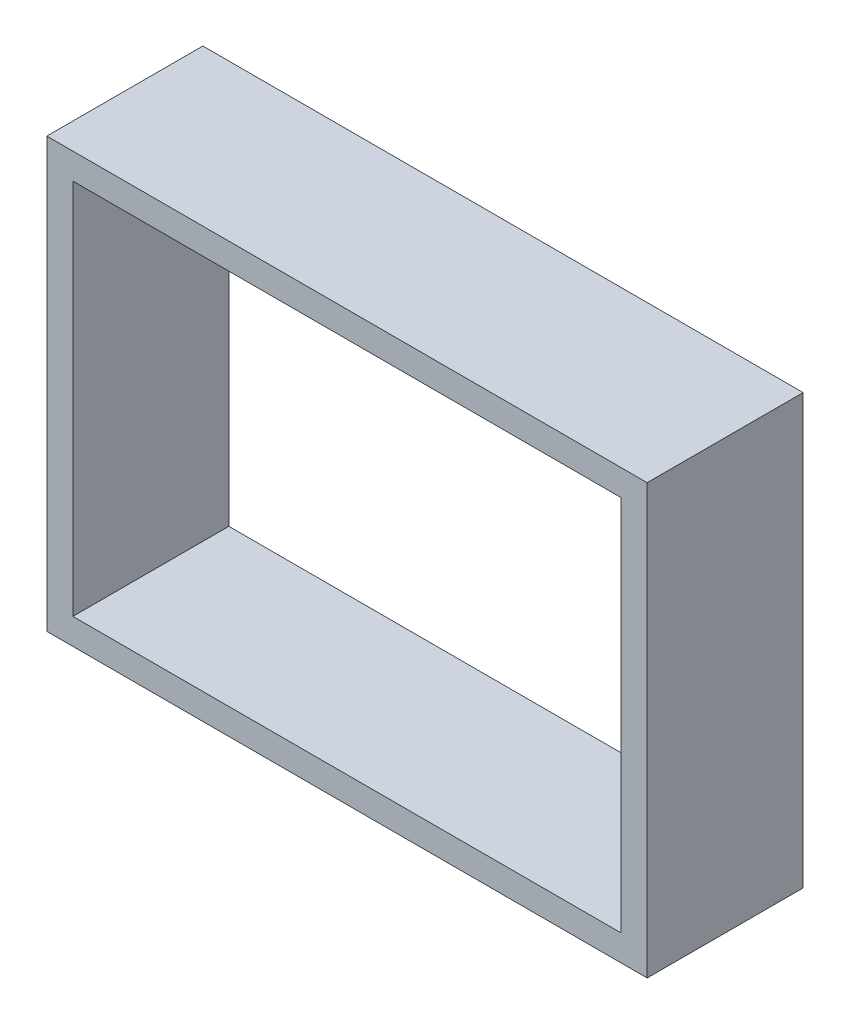
from build123d import *

# Parameters (mm, degrees)
SALIENTE_EXTRUIR1_DEPTH      = 1
SALIENTE_EXTRUIR1_DEPTH_BACK = 23
CROQUIS1_W                   = 92.362259878
CROQUIS1_H                   = 66
CROQUIS1_W_2                 = 84.362259878
CROQUIS1_H_2                 = 58
CROQUIS2_R                   = 4
CORTAR_EXTRUIR1_DEPTH        = 2


with BuildPart() as part:
    # Croquis1 → Saliente-Extruir1 (new, two sides: drawn at the far end of the back side and taken through both)
    with BuildSketch(Plane.XY.offset(-SALIENTE_EXTRUIR1_DEPTH_BACK)):
        with Locations((-8.130399678, 19.75)):
            Rectangle(CROQUIS1_W, CROQUIS1_H)
        with Locations((-8.130399678, 19.75)):
            Rectangle(CROQUIS1_W_2, CROQUIS1_H_2, mode=Mode.SUBTRACT)
    extrude(amount=SALIENTE_EXTRUIR1_DEPTH + SALIENTE_EXTRUIR1_DEPTH_BACK)

    # Croquis2 → Cortar-Extruir1 (cut)
    with BuildSketch(Plane(origin=(0, -13.25, 0), x_dir=(-1, 0, 0), z_dir=(0, -1, 0))):
        with Locations((48.766605031, 3.90477072)):
            Circle(CROQUIS2_R)
    extrude(amount=-CORTAR_EXTRUIR1_DEPTH, mode=Mode.SUBTRACT)


solid = part.part
